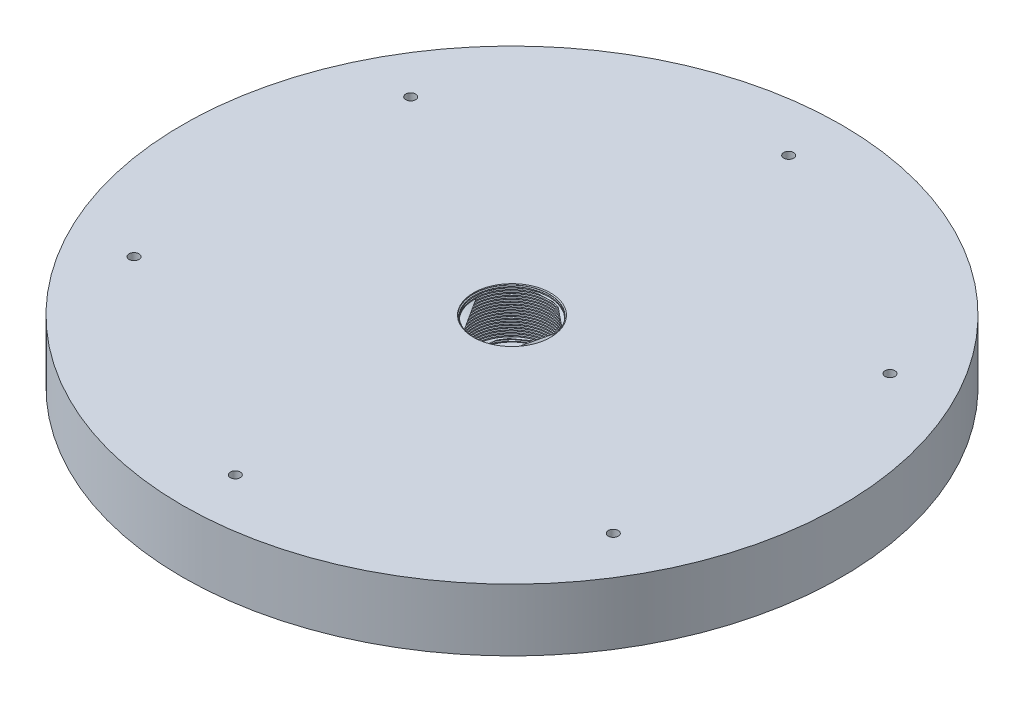
from build123d import *

# Parameters (mm, degrees)
SKETCH1_R           = 265
SKETCH1_R_2         = 4
BOSS_EXTRUDE1_DEPTH = 25
SKETCH2_R           = 30
CUT_EXTRUDE1_DEPTH  = 40
CHAMFER1_SIZE       = 1
THREAD1_PITCH       = 2
BOSS_EXTRUDE2_START = -10
SKETCH3_R           = 265
BOSS_EXTRUDE2_DEPTH = 10


with BuildPart() as part:
    # Sketch1 → Boss-Extrude1 (new, symmetric)
    with BuildSketch(Plane(origin=(0, 0, 0), x_dir=(1, 0, 0), z_dir=(0, 1, 0))):
        with Locations(Location((0, 0, 0), (0, 0, 270))):
            Circle(SKETCH1_R)
        with Locations(Location((0, 222.5, 0), (0, 0, 270))):
            Circle(SKETCH1_R_2, mode=Mode.SUBTRACT)
        with Locations(Location((192.690652342, 111.25, 0), (0, 0, 270))):
            Circle(SKETCH1_R_2, mode=Mode.SUBTRACT)
        with Locations(Location((192.690652342, -111.25, 0), (0, 0, 270))):
            Circle(SKETCH1_R_2, mode=Mode.SUBTRACT)
        with Locations(Location((0, -222.5, 0), (0, 0, 270))):
            Circle(SKETCH1_R_2, mode=Mode.SUBTRACT)
        with Locations(Location((-192.690652342, -111.25, 0), (0, 0, 270))):
            Circle(SKETCH1_R_2, mode=Mode.SUBTRACT)
        with Locations(Location((-192.690652342, 111.25, 0), (0, 0, 270))):
            Circle(SKETCH1_R_2, mode=Mode.SUBTRACT)
    extrude(amount=BOSS_EXTRUDE1_DEPTH, both=True)

    # Sketch2 → Cut-Extrude1 (cut)
    with BuildSketch(Plane(origin=(0, 25, 0), x_dir=(1, 0, 0), z_dir=(0, 1, 0))):
        with Locations(Location((0, 0, 0), (0, 0, 270))):
            Circle(SKETCH2_R)
    extrude(amount=-CUT_EXTRUDE1_DEPTH, mode=Mode.SUBTRACT)

    # Chamfer1
    chamfer1_edges = [part.edges().sort_by_distance(p)[0] for p in [
        (0, 25, -30),
    ]]
    chamfer(chamfer1_edges, length=CHAMFER1_SIZE)

    # Thread1: the profile of Thread Profile1 profile screwed along a right-hand helix of 22 turns, 10 arcs to a turn; built about Z, then put on its axis
    thread1_z = Axis((0, 0, 0), (0, 0, 1))
    thread1_corners = [(29.9997, 0, -0.000173205), (30.811898813, 0, 0.468749998), (30.811898813, 0, 0.656249998), (29.9997, 0, 1.125173201)]
    with BuildLine(mode=Mode.PRIVATE) as thread1_profile:
        Line(thread1_corners[0], thread1_corners[1])
        Line(thread1_corners[1], thread1_corners[2])
        Line(thread1_corners[2], thread1_corners[3])
        Line(thread1_corners[3], thread1_corners[0])
    thread1_cap = Face(thread1_profile.wire())
    thread1_turn_angles = [0, 18, 36, 54, 72, 90, 108, 126, 144, 162, 180, 198, 216, 234, 252, 270, 288, 306, 324, 342, 360]
    thread1_turn_weights = [1, 0.9510565162951535, 1, 0.9510565162951535, 1, 0.9510565162951535, 1, 0.9510565162951535, 1, 0.9510565162951535, 1, 0.9510565162951535, 1, 0.9510565162951535, 1, 0.9510565162951535, 1, 0.9510565162951535, 1, 0.9510565162951535, 1]
    thread1_turn_rails = [Edge.make_bspline([Vector(p[0], p[1], 0).rotate(thread1_z, thread1_turn_angles[k]) / thread1_turn_weights[k] + Vector(0, 0, p[2] + THREAD1_PITCH * thread1_turn_angles[k] / 360) for k in range(21)], [0, 0, 0, 1, 1, 2, 2, 3, 3, 4, 4, 5, 5, 6, 6, 7, 7, 8, 8, 9, 9, 10, 10, 10], 2, thread1_turn_weights) for p in thread1_corners]
    thread1_turn_sides = [Face.make_surface_from_curves(thread1_turn_rails[p[0]], thread1_turn_rails[p[1]]) for p in [(0, 1), (1, 2), (2, 3), (3, 0)]]
    thread1 = Plane(origin=(0, 29, 0), x_dir=(-1, 0, 0), z_dir=(0, -1, 0)) * Solid(Shell([*[p.moved(Location((0, 0, THREAD1_PITCH * i))) for i in range(22) for p in thread1_turn_sides], thread1_cap, thread1_cap.rotate(thread1_z, 7920).moved(Location((0, 0, THREAD1_PITCH * 7920 / 360)))]))
    add(thread1, mode=Mode.SUBTRACT)

    # Sketch3 → Boss-Extrude2 (add)
    with BuildSketch(Plane.XZ.offset(25).offset(BOSS_EXTRUDE2_START)):
        with Locations(Location((0, 0, 0), (0, 0, 90))):
            Circle(SKETCH3_R)
    extrude(amount=BOSS_EXTRUDE2_DEPTH)


solid = part.part
